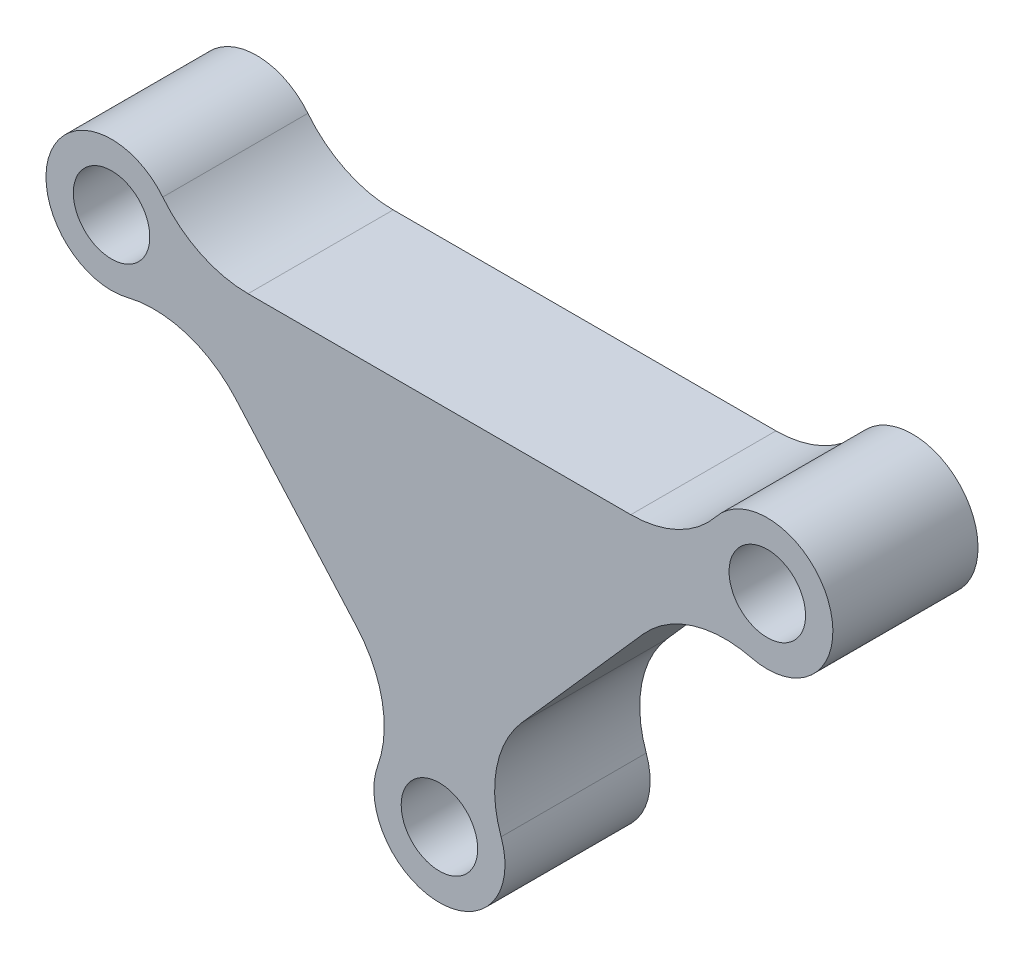
from build123d import *

# Parameters (mm, degrees)
ESQUISSE2_R        = 1.75
BOSS_EXTRU_1_DEPTH = 6.64
CONG_1_R           = 5


with BuildPart() as part:
    # Esquisse2 → Boss.-Extru.1 (new body)
    with BuildSketch(Plane.XY):
        with BuildLine():
            ThreePointArc((-12, 10), (-17.941742027, 10.588348405), (-12.230769231, 8.846153846))
            Line((-12.230769231, 8.846153846), (-0.963712981, -3.909004173))
            ThreePointArc((-0.963712981, -3.909004173), (0, -9.75), (0.963712981, -3.909004173))
            Line((0.963712981, -3.909004173), (12.230769231, 8.846153846))
            ThreePointArc((12.230769231, 8.846153846), (17.941742027, 10.588348405), (12, 10))
            Line((12, 10), (-12, 10))
        make_face()
        with Locations((-15, 10)):
            Circle(ESQUISSE2_R, mode=Mode.SUBTRACT)
        with Locations((15, 10)):
            Circle(ESQUISSE2_R, mode=Mode.SUBTRACT)
        with Locations((0, -6.75)):
            Circle(ESQUISSE2_R, mode=Mode.SUBTRACT)
    extrude(amount=BOSS_EXTRU_1_DEPTH)

    # Congé1
    cong_1_edges = [part.edges().sort_by_distance(p)[0] for p in [
        (-12, 10, 3.32),
        (-12.230769231, 8.846153846, 3.32),
        (-0.963712981, -3.909004173, 3.32),
        (12.230769231, 8.846153846, 3.32),
        (12, 10, 3.32),
        (0.963712981, -3.909004173, 3.32),
    ]]
    fillet(cong_1_edges, radius=CONG_1_R)


solid = part.part
